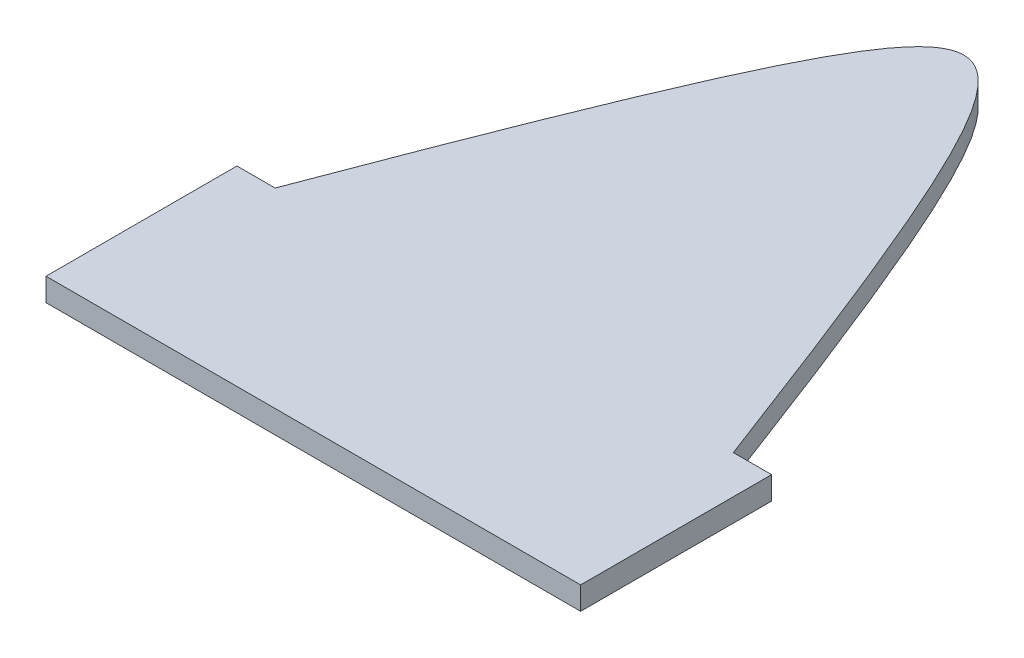
from build123d import *

# Parameters (mm, degrees)
BASE_FLANGE1_DEPTH = 3


# Sheet-metal steps are written as plain solids
with BuildPart() as part:
    # Sketch1 → Base-Flange1 (new body)
    with BuildSketch(Plane(origin=(0, 0, 0), x_dir=(1, 0, 0), z_dir=(0, 1, 0))):
        with BuildLine():
            Line((-30, 0), (-35, 0))
            Line((-35, 0), (-35, -25))
            Line((-35, -25), (35, -25))
            Line((35, -25), (35, 0))
            Line((35, 0), (30, 0))
            add(Edge.make_bspline(
                [(-30, 0), (0, 79.677475969), (30, 0)],
                knots=[0, 0, 0, 1, 1, 1], degree=2, weights=[1, 3.083399466, 1]))
        make_face()
    extrude(amount=-BASE_FLANGE1_DEPTH)


solid = part.part
